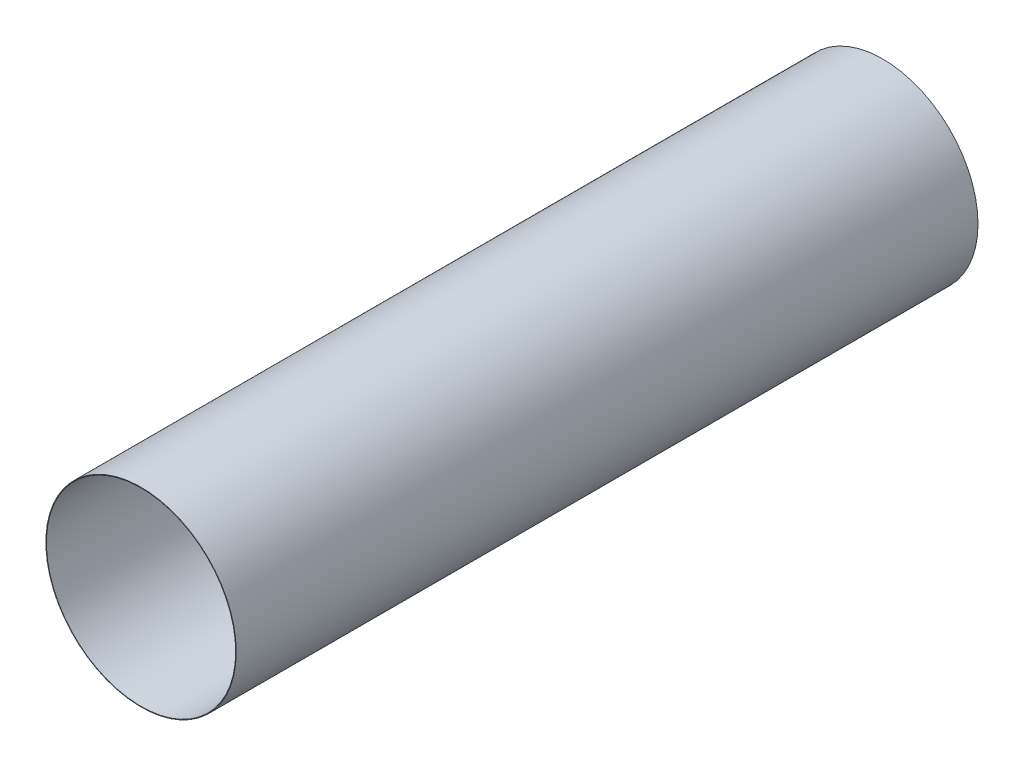
from build123d import *

# Parameters (mm, degrees)
SKETCH2_W = 1181.1
SKETCH2_H = 0.85


with BuildPart() as part:
    # Sketch2 → Revolve1 (revolve)
    with BuildSketch(Plane(origin=(0, 0, 0), x_dir=(0, 0, -1), z_dir=(1, 0, 0))):
        with Locations((0, 151.170087811)):
            Rectangle(SKETCH2_W, SKETCH2_H)
    revolve(axis=Axis((0, 0, 754.38), (0, 0, -1)))


solid = part.part
